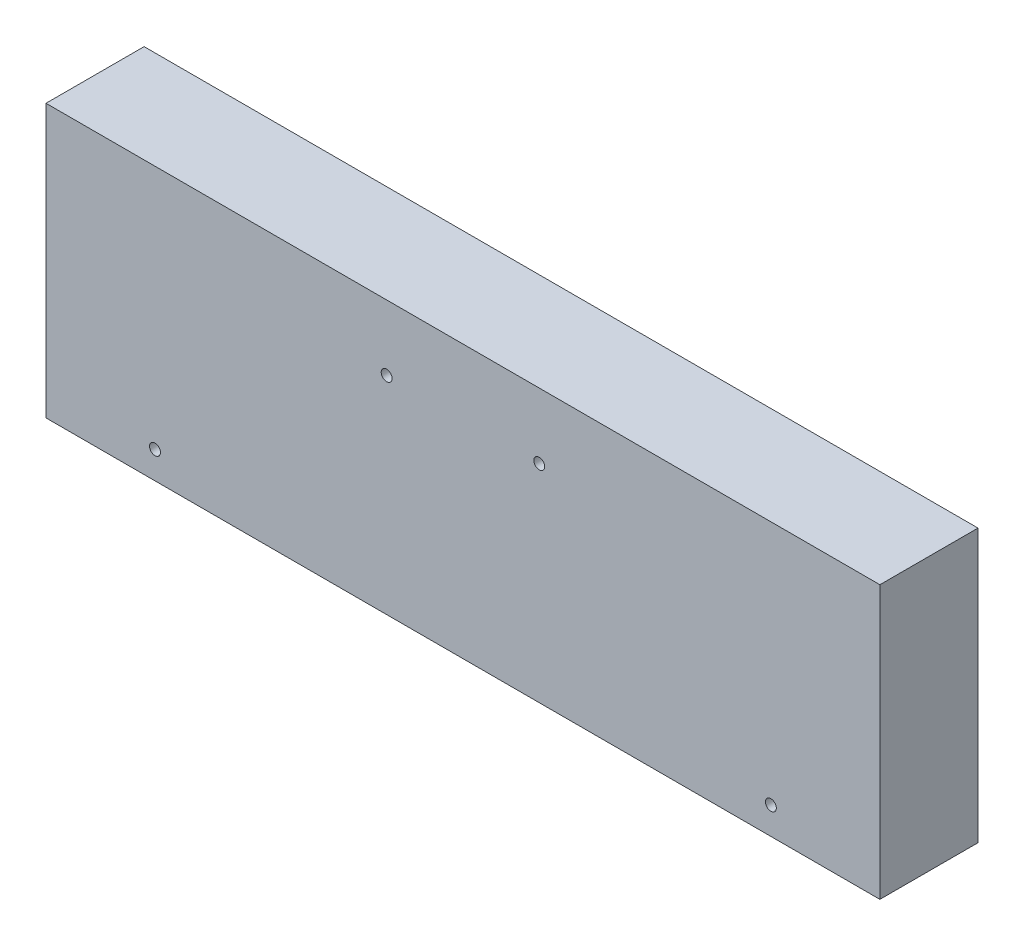
from build123d import *

# Parameters (mm, degrees)
SKETCH1_W           = 153
SKETCH1_H           = 50
SKETCH1_R           = 1
BOSS_EXTRUDE1_DEPTH = 18


with BuildPart() as part:
    # Sketch1 → Boss-Extrude1 (new body)
    with BuildSketch(Plane.XY):
        Rectangle(SKETCH1_W, SKETCH1_H)
        with Locations((-14, 13)):
            Circle(SKETCH1_R, mode=Mode.SUBTRACT)
        with Locations((14, 13)):
            Circle(SKETCH1_R, mode=Mode.SUBTRACT)
        with Locations((-56.5, -20)):
            Circle(SKETCH1_R, mode=Mode.SUBTRACT)
        with Locations((56.5, -20)):
            Circle(SKETCH1_R, mode=Mode.SUBTRACT)
    extrude(amount=BOSS_EXTRUDE1_DEPTH)


solid = part.part
